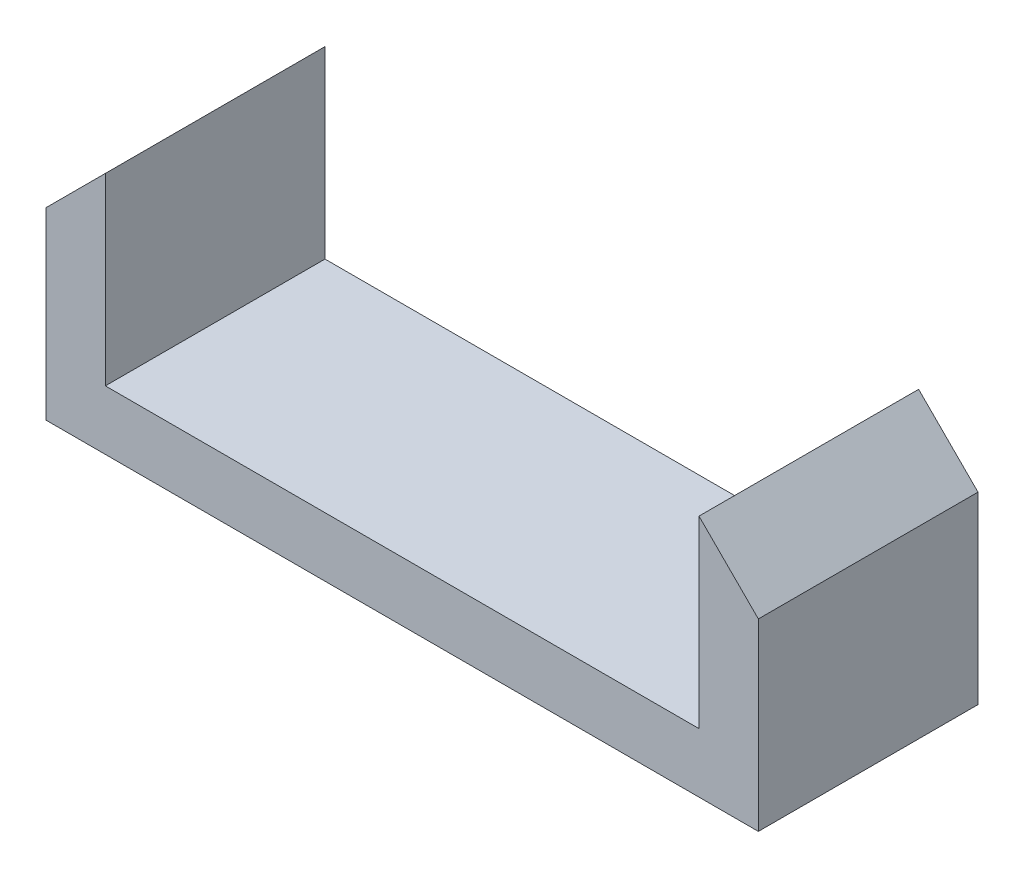
from build123d import *

# Parameters (mm, degrees)
SKETCH1_W           = 12
SKETCH1_H           = 4.1
BOSS_EXTRUDE1_DEPTH = 3.7
CUT_EXTRUDE1_DEPTH  = 3.7
CUT_EXTRUDE2_DEPTH  = 3.7
SKETCH5_R           = 1.3
BOSS_EXTRUDE2_DEPTH = 0.4
FILLET1_R           = 0.5
SKETCH6_W           = 10
SKETCH6_H           = 3.1
CUT_EXTRUDE3_DEPTH  = 19.226253597


with BuildPart() as part:
    # Sketch1 → Boss-Extrude1 (new body)
    with BuildSketch(Plane.XY):
        with Locations((-6, 11.160084034)):
            Rectangle(SKETCH1_W, SKETCH1_H)
    extrude(amount=BOSS_EXTRUDE1_DEPTH)

    # Sketch3 → Cut-Extrude1 (cut)
    with BuildSketch(Plane.XY.offset(3.7)):
        Polygon((-1, 13.210084034), (0, 13.210084034), (0, 12.210084034), align=None)
    extrude(amount=-CUT_EXTRUDE1_DEPTH, mode=Mode.SUBTRACT)

    # Sketch4 → Cut-Extrude2 (cut)
    with BuildSketch(Plane.XY.offset(3.7)):
        Polygon((-12, 13.210084034), (-11, 13.210084034), (-12, 12.210084034), align=None)
    extrude(amount=-CUT_EXTRUDE2_DEPTH, mode=Mode.SUBTRACT)

    # Sketch5 → Boss-Extrude2 (add)
    with BuildSketch(Plane.XZ.offset(-9.110084034)):
        with Locations(Location((-6, 1.7, 0), (0, 0, 270))):
            Circle(SKETCH5_R)
    extrude(amount=BOSS_EXTRUDE2_DEPTH)

    # Fillet1
    # the kernel refuses this fillet: 0.5 mm, written as the material it takes off along each edge
    with BuildSketch(Plane(origin=(-6, 8.710084034, 1.7), x_dir=(0, 0, -1), z_dir=(-1, 0, 0))) as fillet1_piece_1:
        with BuildLine():
            CenterArc((0.810102051, -0.5), FILLET1_R, 11.536959033, 78.463040967)
            Line((0.810102051, 0), (0.810102051, 0.01))
            Line((0.810102051, 0.01), (1.3, 0.01))
            Line((1.3, 0.01), (1.31, 0))
            ThreePointArc((1.31, 0), (1.31, -0.2), (1.309797959, -0.398))
            Line((1.309797959, -0.398), (1.3, -0.4))
        make_face()
    revolve(axis=Axis((-6, 8.710084034, 1.7), (0, -1, 0)), mode=Mode.SUBTRACT)

    # Sketch6 → Cut-Extrude3 (cut, through all)
    with BuildSketch(Plane.XY.offset(3.7)):
        with Locations((-6, 11.660084034)):
            Rectangle(SKETCH6_W, SKETCH6_H)
    extrude(amount=-CUT_EXTRUDE3_DEPTH, mode=Mode.SUBTRACT)


solid = part.part
